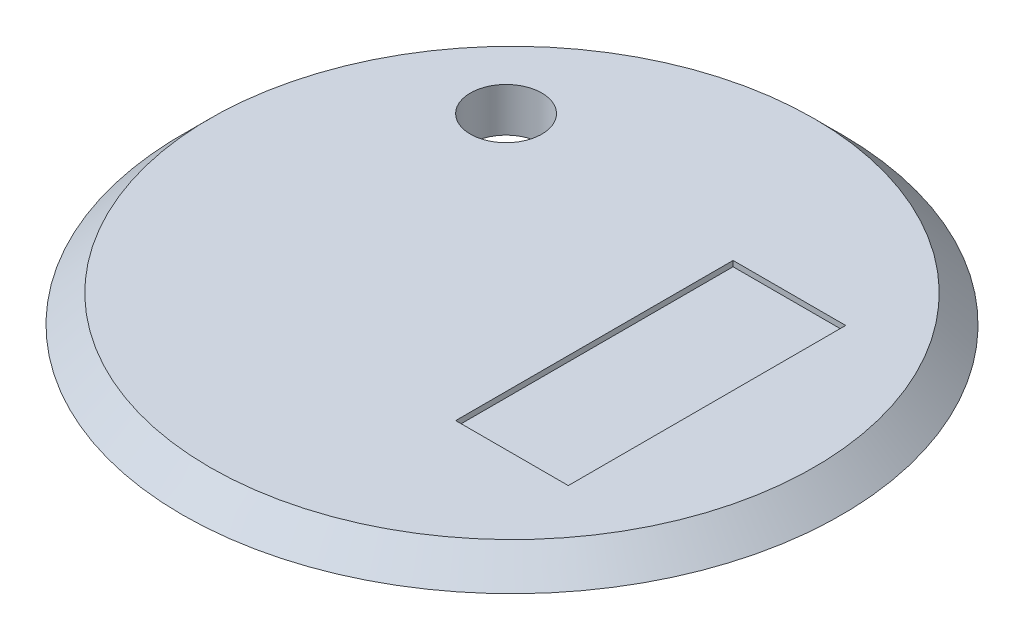
from build123d import *

# Parameters (mm, degrees)
SKETCH1_R           = 60
BOSS_EXTRUDE1_DEPTH = 5
SKETCH2_R           = 49.5
BOSS_EXTRUDE2_DEPTH = 3
CHAMFER1_SIZE       = 5
CAVITY3_START       = -3
CAVITY3_OUTLINE_R   = 1.03
CAVITY3_DEPTH       = 4.97
CAVITY3_START_2     = -0.09
CAVITY3_2_OUTLINE_R = 1.6995
CAVITY3_2_DEPTH     = 2.06
CAVITY3_START_3     = 1.97
CAVITY3_3_OUTLINE_R = 2.8325
CAVITY3_3_DEPTH     = 1.03
SKETCH3_R           = 1.03
SKETCH3_R_2         = 4.12
CUT_EXTRUDE1_DEPTH  = 4.97
SKETCH4_R           = 2.8325
CUT_EXTRUDE2_DEPTH  = 1
SKETCH5_W           = 20.5
SKETCH5_H           = 50.5
CUT_EXTRUDE3_DEPTH  = 1
SKETCH6_R           = 6.5
CUT_EXTRUDE4_DEPTH  = 86.229103011


with BuildPart() as part:
    # Sketch1 → Boss-Extrude1 (new body)
    with BuildSketch(Plane(origin=(0, 0, 0), x_dir=(1, 0, 0), z_dir=(0, 1, 0))):
        with Locations(Location((0, 0, 0), (0, 0, 270))):
            Circle(SKETCH1_R)
    extrude(amount=BOSS_EXTRUDE1_DEPTH)

    # Sketch2 → Boss-Extrude2 (add)
    with BuildSketch(Plane.XZ):
        with Locations(Location((0, 0, 0), (0, 0, 270))):
            Circle(SKETCH2_R)
    extrude(amount=BOSS_EXTRUDE2_DEPTH)

    # Chamfer1
    chamfer1_edges = [part.edges().sort_by_distance(p)[0] for p in [
        (0, 5, -60),
    ]]
    chamfer(chamfer1_edges, length=CHAMFER1_SIZE - 0.0001)  # a hair under: the kernel refuses the full size

    # Cavity3: read off the stored shape, not the designer's step
    # Cavity3 outline → Cavity3 (cut)
    with BuildSketch(Plane(origin=(0, 0, 0), x_dir=(1, 0, 0), z_dir=(0, 1, 0)).offset(CAVITY3_START)):
        with BuildLine():
            Line((24.463108255, 3.105757511), (8.115613404, 4.990999431))
            ThreePointArc((8.115613404, 4.990999431), (6.655003546, 6.817931068), (4.793285171, 8.233934267))
            Line((4.793285171, 8.233934267), (2.513273505, 24.531058916))
            ThreePointArc((2.513273505, 24.531058916), (-0.326157735, 26.970899519), (-3.105757511, 24.463108255))
            Line((-3.105757511, 24.463108255), (-4.990999431, 8.115613404))
            ThreePointArc((-4.990999431, 8.115613404), (-6.817931068, 6.655003546), (-8.233934267, 4.793285171))
            Line((-8.233934267, 4.793285171), (-24.531058916, 2.513273505))
            ThreePointArc((-24.531058916, 2.513273505), (-26.970899519, -0.326157735), (-24.463108255, -3.105757511))
            Line((-24.463108255, -3.105757511), (-8.115613404, -4.990999431))
            ThreePointArc((-8.115613404, -4.990999431), (-6.655003546, -6.817931068), (-4.793285171, -8.233934267))
            Line((-4.793285171, -8.233934267), (-2.513273505, -24.531058916))
            ThreePointArc((-2.513273505, -24.531058916), (0.326157735, -26.970899519), (3.105757511, -24.463108255))
            Line((3.105757511, -24.463108255), (4.990999431, -8.115613404))
            ThreePointArc((4.990999431, -8.115613404), (6.817931068, -6.655003546), (8.233934267, -4.793285171))
            Line((8.233934267, -4.793285171), (24.531058916, -2.513273505))
            ThreePointArc((24.531058916, -2.513273505), (26.970899519, 0.326157735), (24.463108255, 3.105757511))
        make_face()
        with Locations((-23.945749158, -0.289574743)):
            Circle(CAVITY3_OUTLINE_R, mode=Mode.SUBTRACT)
        with Locations((-18.796125683, -0.227300605)):
            Circle(CAVITY3_OUTLINE_R, mode=Mode.SUBTRACT)
        with Locations((-13.646502208, -0.165026467)):
            Circle(CAVITY3_OUTLINE_R, mode=Mode.SUBTRACT)
        with Locations((-8.496878733, -0.102752328)):
            Circle(CAVITY3_OUTLINE_R, mode=Mode.SUBTRACT)
        with BuildLine():
            Line((3.503478055, -0.1010505), (4.112023478, -0.256247761))
            ThreePointArc((4.112023478, -0.256247761), (4.090956911, -0.488335495), (4.056801586, -0.718860831))
            Line((4.056801586, -0.718860831), (3.428823838, -0.726454935))
            Line((3.428823838, -0.726454935), (3.357946141, -1.004374133))
            Line((3.357946141, -1.004374133), (3.905587875, -1.31178632))
            ThreePointArc((3.905587875, -1.31178632), (3.825170408, -1.530513428), (3.73251455, -1.744343755))
            Line((3.73251455, -1.744343755), (3.123969126, -1.589146495))
            Line((3.123969126, -1.589146495), (2.983575747, -1.839251328))
            Line((2.983575747, -1.839251328), (3.432992913, -2.27792881))
            ThreePointArc((3.432992913, -2.27792881), (3.298704863, -2.4683894), (3.153862816, -2.650952535))
            Line((3.153862816, -2.650952535), (2.606221081, -2.343540347))
            Line((2.606221081, -2.343540347), (2.405879596, -2.548786584))
            Line((2.405879596, -2.548786584), (2.726445157, -3.088834215))
            ThreePointArc((2.726445157, -3.088834215), (2.547438033, -3.238048713), (2.360280543, -3.37690328))
            Line((2.360280543, -3.37690328), (1.910863377, -2.938225798))
            Line((1.910863377, -2.938225798), (1.664226727, -3.084626247))
            Line((1.664226727, -3.084626247), (1.834094669, -3.689240673))
            ThreePointArc((1.834094669, -3.689240673), (1.622567511, -3.787040358), (1.405849051, -3.872723647))
            Line((1.405849051, -3.872723647), (1.085283491, -3.332676016))
            Line((1.085283491, -3.332676016), (0.809159557, -3.410253729))
            Line((0.809159557, -3.410253729), (0.81675366, -4.038231477))
            ThreePointArc((0.81675366, -4.038231477), (0.587121694, -4.077951461), (0.35561127, -4.104624298))
            Line((0.35561127, -4.104624298), (0.185743328, -3.500009871))
            Line((0.185743328, -3.500009871), (-0.1010505, -3.503478055))
            Line((-0.1010505, -3.503478055), (-0.256247761, -4.112023478))
            ThreePointArc((-0.256247761, -4.112023478), (-0.488335495, -4.090956911), (-0.718860831, -4.056801586))
            Line((-0.718860831, -4.056801586), (-0.726454935, -3.428823838))
            Line((-0.726454935, -3.428823838), (-1.004374133, -3.357946141))
            Line((-1.004374133, -3.357946141), (-1.31178632, -3.905587875))
            ThreePointArc((-1.31178632, -3.905587875), (-1.530513428, -3.825170408), (-1.744343755, -3.73251455))
            Line((-1.744343755, -3.73251455), (-1.589146495, -3.123969126))
            Line((-1.589146495, -3.123969126), (-1.839251328, -2.983575747))
            Line((-1.839251328, -2.983575747), (-2.27792881, -3.432992913))
            ThreePointArc((-2.27792881, -3.432992913), (-2.4683894, -3.298704863), (-2.650952535, -3.153862816))
            Line((-2.650952535, -3.153862816), (-2.343540347, -2.606221081))
            Line((-2.343540347, -2.606221081), (-2.548786584, -2.405879596))
            Line((-2.548786584, -2.405879596), (-3.088834215, -2.726445157))
            ThreePointArc((-3.088834215, -2.726445157), (-3.238048713, -2.547438033), (-3.37690328, -2.360280543))
            Line((-3.37690328, -2.360280543), (-2.938225798, -1.910863377))
            Line((-2.938225798, -1.910863377), (-3.084626247, -1.664226727))
            Line((-3.084626247, -1.664226727), (-3.689240673, -1.834094669))
            ThreePointArc((-3.689240673, -1.834094669), (-3.787040358, -1.622567511), (-3.872723647, -1.405849051))
            Line((-3.872723647, -1.405849051), (-3.332676016, -1.085283491))
            Line((-3.332676016, -1.085283491), (-3.410253729, -0.809159557))
            Line((-3.410253729, -0.809159557), (-4.038231477, -0.81675366))
            ThreePointArc((-4.038231477, -0.81675366), (-4.077951461, -0.587121694), (-4.104624298, -0.35561127))
            Line((-4.104624298, -0.35561127), (-3.500009871, -0.185743328))
            Line((-3.500009871, -0.185743328), (-3.503478055, 0.1010505))
            Line((-3.503478055, 0.1010505), (-4.112023478, 0.256247761))
            ThreePointArc((-4.112023478, 0.256247761), (-4.090956911, 0.488335495), (-4.056801586, 0.718860831))
            Line((-4.056801586, 0.718860831), (-3.428823838, 0.726454935))
            Line((-3.428823838, 0.726454935), (-3.357946141, 1.004374133))
            Line((-3.357946141, 1.004374133), (-3.905587875, 1.31178632))
            ThreePointArc((-3.905587875, 1.31178632), (-3.825170408, 1.530513428), (-3.73251455, 1.744343755))
            Line((-3.73251455, 1.744343755), (-3.123969126, 1.589146495))
            Line((-3.123969126, 1.589146495), (-2.983575747, 1.839251328))
            Line((-2.983575747, 1.839251328), (-3.432992913, 2.27792881))
            ThreePointArc((-3.432992913, 2.27792881), (-3.298704863, 2.4683894), (-3.153862816, 2.650952535))
            Line((-3.153862816, 2.650952535), (-2.606221081, 2.343540347))
            Line((-2.606221081, 2.343540347), (-2.405879596, 2.548786584))
            Line((-2.405879596, 2.548786584), (-2.726445157, 3.088834215))
            ThreePointArc((-2.726445157, 3.088834215), (-2.547438033, 3.238048713), (-2.360280543, 3.37690328))
            Line((-2.360280543, 3.37690328), (-1.910863377, 2.938225798))
            Line((-1.910863377, 2.938225798), (-1.664226727, 3.084626247))
            Line((-1.664226727, 3.084626247), (-1.834094669, 3.689240673))
            ThreePointArc((-1.834094669, 3.689240673), (-1.622567511, 3.787040358), (-1.405849051, 3.872723647))
            Line((-1.405849051, 3.872723647), (-1.085283491, 3.332676016))
            Line((-1.085283491, 3.332676016), (-0.809159557, 3.410253729))
            Line((-0.809159557, 3.410253729), (-0.81675366, 4.038231477))
            ThreePointArc((-0.81675366, 4.038231477), (-0.587121694, 4.077951461), (-0.35561127, 4.104624298))
            Line((-0.35561127, 4.104624298), (-0.185743328, 3.500009871))
            Line((-0.185743328, 3.500009871), (0.1010505, 3.503478055))
            Line((0.1010505, 3.503478055), (0.256247761, 4.112023478))
            ThreePointArc((0.256247761, 4.112023478), (0.488335495, 4.090956911), (0.718860831, 4.056801586))
            Line((0.718860831, 4.056801586), (0.726454935, 3.428823838))
            Line((0.726454935, 3.428823838), (1.004374133, 3.357946141))
            Line((1.004374133, 3.357946141), (1.31178632, 3.905587875))
            ThreePointArc((1.31178632, 3.905587875), (1.530513428, 3.825170408), (1.744343755, 3.73251455))
            Line((1.744343755, 3.73251455), (1.589146495, 3.123969126))
            Line((1.589146495, 3.123969126), (1.839251328, 2.983575747))
            Line((1.839251328, 2.983575747), (2.27792881, 3.432992913))
            ThreePointArc((2.27792881, 3.432992913), (2.4683894, 3.298704863), (2.650952535, 3.153862816))
            Line((2.650952535, 3.153862816), (2.343540347, 2.606221081))
            Line((2.343540347, 2.606221081), (2.548786584, 2.405879596))
            Line((2.548786584, 2.405879596), (3.088834215, 2.726445157))
            ThreePointArc((3.088834215, 2.726445157), (3.238048713, 2.547438033), (3.37690328, 2.360280543))
            Line((3.37690328, 2.360280543), (2.938225798, 1.910863377))
            Line((2.938225798, 1.910863377), (3.084626247, 1.664226727))
            Line((3.084626247, 1.664226727), (3.689240673, 1.834094669))
            ThreePointArc((3.689240673, 1.834094669), (3.787040358, 1.622567511), (3.872723647, 1.405849051))
            Line((3.872723647, 1.405849051), (3.332676016, 1.085283491))
            Line((3.332676016, 1.085283491), (3.410253729, 0.809159557))
            Line((3.410253729, 0.809159557), (4.038231477, 0.81675366))
            ThreePointArc((4.038231477, 0.81675366), (4.077951461, 0.587121694), (4.104624298, 0.35561127))
            Line((4.104624298, 0.35561127), (3.500009871, 0.185743328))
            Line((3.500009871, 0.185743328), (3.503478055, -0.1010505))
        make_face(mode=Mode.SUBTRACT)
        with Locations((0.289574743, -23.945749158)):
            Circle(CAVITY3_OUTLINE_R, mode=Mode.SUBTRACT)
        with Locations((0.227300605, -18.796125683)):
            Circle(CAVITY3_OUTLINE_R, mode=Mode.SUBTRACT)
        with Locations((0.165026467, -13.646502208)):
            Circle(CAVITY3_OUTLINE_R, mode=Mode.SUBTRACT)
        with Locations((0.102752328, -8.496878733)):
            Circle(CAVITY3_OUTLINE_R, mode=Mode.SUBTRACT)
        with Locations((-0.102752328, 8.496878733)):
            Circle(CAVITY3_OUTLINE_R, mode=Mode.SUBTRACT)
        with Locations((-0.165026467, 13.646502208)):
            Circle(CAVITY3_OUTLINE_R, mode=Mode.SUBTRACT)
        with Locations((-0.227300605, 18.796125683)):
            Circle(CAVITY3_OUTLINE_R, mode=Mode.SUBTRACT)
        with Locations((-0.289574743, 23.945749158)):
            Circle(CAVITY3_OUTLINE_R, mode=Mode.SUBTRACT)
        with Locations((8.496878733, 0.102752328)):
            Circle(CAVITY3_OUTLINE_R, mode=Mode.SUBTRACT)
        with Locations((13.646502208, 0.165026467)):
            Circle(CAVITY3_OUTLINE_R, mode=Mode.SUBTRACT)
        with Locations((18.796125683, 0.227300605)):
            Circle(CAVITY3_OUTLINE_R, mode=Mode.SUBTRACT)
        with Locations((23.945749158, 0.289574743)):
            Circle(CAVITY3_OUTLINE_R, mode=Mode.SUBTRACT)
    extrude(amount=CAVITY3_DEPTH, mode=Mode.SUBTRACT)

    # Cavity3 2 outline → Cavity3 2 (cut)
    with BuildSketch(Plane(origin=(0, 0, 0), x_dir=(1, 0, 0), z_dir=(0, 1, 0)).offset(CAVITY3_START_2)):
        with BuildLine():
            ThreePointArc((4.056801586, -0.718860831), (4.090956911, -0.488335495), (4.112023478, -0.256247761))
            Line((4.112023478, -0.256247761), (3.503478055, -0.1010505))
            Line((3.503478055, -0.1010505), (3.500009871, 0.185743328))
            Line((3.500009871, 0.185743328), (4.104624298, 0.35561127))
            ThreePointArc((4.104624298, 0.35561127), (4.077951461, 0.587121694), (4.038231477, 0.81675366))
            Line((4.038231477, 0.81675366), (3.410253729, 0.809159557))
            Line((3.410253729, 0.809159557), (3.332676016, 1.085283491))
            Line((3.332676016, 1.085283491), (3.872723647, 1.405849051))
            ThreePointArc((3.872723647, 1.405849051), (3.787040358, 1.622567511), (3.689240673, 1.834094669))
            Line((3.689240673, 1.834094669), (3.084626247, 1.664226727))
            Line((3.084626247, 1.664226727), (2.938225798, 1.910863377))
            Line((2.938225798, 1.910863377), (3.37690328, 2.360280543))
            ThreePointArc((3.37690328, 2.360280543), (3.238048713, 2.547438033), (3.088834215, 2.726445157))
            Line((3.088834215, 2.726445157), (2.548786584, 2.405879596))
            Line((2.548786584, 2.405879596), (2.343540347, 2.606221081))
            Line((2.343540347, 2.606221081), (2.650952535, 3.153862816))
            ThreePointArc((2.650952535, 3.153862816), (2.4683894, 3.298704863), (2.27792881, 3.432992913))
            Line((2.27792881, 3.432992913), (1.839251328, 2.983575747))
            Line((1.839251328, 2.983575747), (1.589146495, 3.123969126))
            Line((1.589146495, 3.123969126), (1.744343755, 3.73251455))
            ThreePointArc((1.744343755, 3.73251455), (1.530513428, 3.825170408), (1.31178632, 3.905587875))
            Line((1.31178632, 3.905587875), (1.004374133, 3.357946141))
            Line((1.004374133, 3.357946141), (0.726454935, 3.428823838))
            Line((0.726454935, 3.428823838), (0.718860831, 4.056801586))
            ThreePointArc((0.718860831, 4.056801586), (0.488335495, 4.090956911), (0.256247761, 4.112023478))
            Line((0.256247761, 4.112023478), (0.1010505, 3.503478055))
            Line((0.1010505, 3.503478055), (-0.185743328, 3.500009871))
            Line((-0.185743328, 3.500009871), (-0.35561127, 4.104624298))
            ThreePointArc((-0.35561127, 4.104624298), (-0.587121694, 4.077951461), (-0.81675366, 4.038231477))
            Line((-0.81675366, 4.038231477), (-0.809159557, 3.410253729))
            Line((-0.809159557, 3.410253729), (-1.085283491, 3.332676016))
            Line((-1.085283491, 3.332676016), (-1.405849051, 3.872723647))
            ThreePointArc((-1.405849051, 3.872723647), (-1.622567511, 3.787040358), (-1.834094669, 3.689240673))
            Line((-1.834094669, 3.689240673), (-1.664226727, 3.084626247))
            Line((-1.664226727, 3.084626247), (-1.910863377, 2.938225798))
            Line((-1.910863377, 2.938225798), (-2.360280543, 3.37690328))
            ThreePointArc((-2.360280543, 3.37690328), (-2.547438033, 3.238048713), (-2.726445157, 3.088834215))
            Line((-2.726445157, 3.088834215), (-2.405879596, 2.548786584))
            Line((-2.405879596, 2.548786584), (-2.606221081, 2.343540347))
            Line((-2.606221081, 2.343540347), (-3.153862816, 2.650952535))
            ThreePointArc((-3.153862816, 2.650952535), (-3.298704863, 2.4683894), (-3.432992913, 2.27792881))
            Line((-3.432992913, 2.27792881), (-2.983575747, 1.839251328))
            Line((-2.983575747, 1.839251328), (-3.123969126, 1.589146495))
            Line((-3.123969126, 1.589146495), (-3.73251455, 1.744343755))
            ThreePointArc((-3.73251455, 1.744343755), (-3.825170408, 1.530513428), (-3.905587875, 1.31178632))
            Line((-3.905587875, 1.31178632), (-3.357946141, 1.004374133))
            Line((-3.357946141, 1.004374133), (-3.428823838, 0.726454935))
            Line((-3.428823838, 0.726454935), (-4.056801586, 0.718860831))
            ThreePointArc((-4.056801586, 0.718860831), (-4.090956911, 0.488335495), (-4.112023478, 0.256247761))
            Line((-4.112023478, 0.256247761), (-3.503478055, 0.1010505))
            Line((-3.503478055, 0.1010505), (-3.500009871, -0.185743328))
            Line((-3.500009871, -0.185743328), (-4.104624298, -0.35561127))
            ThreePointArc((-4.104624298, -0.35561127), (-4.077951461, -0.587121694), (-4.038231477, -0.81675366))
            Line((-4.038231477, -0.81675366), (-3.410253729, -0.809159557))
            Line((-3.410253729, -0.809159557), (-3.332676016, -1.085283491))
            Line((-3.332676016, -1.085283491), (-3.872723647, -1.405849051))
            ThreePointArc((-3.872723647, -1.405849051), (-3.787040358, -1.622567511), (-3.689240673, -1.834094669))
            Line((-3.689240673, -1.834094669), (-3.084626247, -1.664226727))
            Line((-3.084626247, -1.664226727), (-2.938225798, -1.910863377))
            Line((-2.938225798, -1.910863377), (-3.37690328, -2.360280543))
            ThreePointArc((-3.37690328, -2.360280543), (-3.238048713, -2.547438033), (-3.088834215, -2.726445157))
            Line((-3.088834215, -2.726445157), (-2.548786584, -2.405879596))
            Line((-2.548786584, -2.405879596), (-2.343540347, -2.606221081))
            Line((-2.343540347, -2.606221081), (-2.650952535, -3.153862816))
            ThreePointArc((-2.650952535, -3.153862816), (-2.4683894, -3.298704863), (-2.27792881, -3.432992913))
            Line((-2.27792881, -3.432992913), (-1.839251328, -2.983575747))
            Line((-1.839251328, -2.983575747), (-1.589146495, -3.123969126))
            Line((-1.589146495, -3.123969126), (-1.744343755, -3.73251455))
            ThreePointArc((-1.744343755, -3.73251455), (-1.530513428, -3.825170408), (-1.31178632, -3.905587875))
            Line((-1.31178632, -3.905587875), (-1.004374133, -3.357946141))
            Line((-1.004374133, -3.357946141), (-0.726454935, -3.428823838))
            Line((-0.726454935, -3.428823838), (-0.718860831, -4.056801586))
            ThreePointArc((-0.718860831, -4.056801586), (-0.488335495, -4.090956911), (-0.256247761, -4.112023478))
            Line((-0.256247761, -4.112023478), (-0.1010505, -3.503478055))
            Line((-0.1010505, -3.503478055), (0.185743328, -3.500009871))
            Line((0.185743328, -3.500009871), (0.35561127, -4.104624298))
            ThreePointArc((0.35561127, -4.104624298), (0.587121694, -4.077951461), (0.81675366, -4.038231477))
            Line((0.81675366, -4.038231477), (0.809159557, -3.410253729))
            Line((0.809159557, -3.410253729), (1.085283491, -3.332676016))
            Line((1.085283491, -3.332676016), (1.405849051, -3.872723647))
            ThreePointArc((1.405849051, -3.872723647), (1.622567511, -3.787040358), (1.834094669, -3.689240673))
            Line((1.834094669, -3.689240673), (1.664226727, -3.084626247))
            Line((1.664226727, -3.084626247), (1.910863377, -2.938225798))
            Line((1.910863377, -2.938225798), (2.360280543, -3.37690328))
            ThreePointArc((2.360280543, -3.37690328), (2.547438033, -3.238048713), (2.726445157, -3.088834215))
            Line((2.726445157, -3.088834215), (2.405879596, -2.548786584))
            Line((2.405879596, -2.548786584), (2.606221081, -2.343540347))
            Line((2.606221081, -2.343540347), (3.153862816, -2.650952535))
            ThreePointArc((3.153862816, -2.650952535), (3.298704863, -2.4683894), (3.432992913, -2.27792881))
            Line((3.432992913, -2.27792881), (2.983575747, -1.839251328))
            Line((2.983575747, -1.839251328), (3.123969126, -1.589146495))
            Line((3.123969126, -1.589146495), (3.73251455, -1.744343755))
            ThreePointArc((3.73251455, -1.744343755), (3.825170408, -1.530513428), (3.905587875, -1.31178632))
            Line((3.905587875, -1.31178632), (3.357946141, -1.004374133))
            Line((3.357946141, -1.004374133), (3.428823838, -0.726454935))
            Line((3.428823838, -0.726454935), (4.056801586, -0.718860831))
        make_face()
        Circle(CAVITY3_2_OUTLINE_R, mode=Mode.SUBTRACT)
    extrude(amount=CAVITY3_2_DEPTH, mode=Mode.SUBTRACT)

    # Cavity3 3 outline → Cavity3 3 (cut)
    with BuildSketch(Plane(origin=(0, 0, 0), x_dir=(1, 0, 0), z_dir=(0, 1, 0)).offset(CAVITY3_START_3)):
        with BuildLine():
            ThreePointArc((4.056801586, -0.718860831), (4.090956911, -0.488335495), (4.112023478, -0.256247761))
            Line((4.112023478, -0.256247761), (3.503478055, -0.1010505))
            Line((3.503478055, -0.1010505), (3.500009871, 0.185743328))
            Line((3.500009871, 0.185743328), (4.104624298, 0.35561127))
            ThreePointArc((4.104624298, 0.35561127), (4.077951461, 0.587121694), (4.038231477, 0.81675366))
            Line((4.038231477, 0.81675366), (3.410253729, 0.809159557))
            Line((3.410253729, 0.809159557), (3.332676016, 1.085283491))
            Line((3.332676016, 1.085283491), (3.872723647, 1.405849051))
            ThreePointArc((3.872723647, 1.405849051), (3.787040358, 1.622567511), (3.689240673, 1.834094669))
            Line((3.689240673, 1.834094669), (3.084626247, 1.664226727))
            Line((3.084626247, 1.664226727), (2.938225798, 1.910863377))
            Line((2.938225798, 1.910863377), (3.37690328, 2.360280543))
            ThreePointArc((3.37690328, 2.360280543), (3.238048713, 2.547438033), (3.088834215, 2.726445157))
            Line((3.088834215, 2.726445157), (2.548786584, 2.405879596))
            Line((2.548786584, 2.405879596), (2.343540347, 2.606221081))
            Line((2.343540347, 2.606221081), (2.650952535, 3.153862816))
            ThreePointArc((2.650952535, 3.153862816), (2.4683894, 3.298704863), (2.27792881, 3.432992913))
            Line((2.27792881, 3.432992913), (1.839251328, 2.983575747))
            Line((1.839251328, 2.983575747), (1.589146495, 3.123969126))
            Line((1.589146495, 3.123969126), (1.744343755, 3.73251455))
            ThreePointArc((1.744343755, 3.73251455), (1.530513428, 3.825170408), (1.31178632, 3.905587875))
            Line((1.31178632, 3.905587875), (1.004374133, 3.357946141))
            Line((1.004374133, 3.357946141), (0.726454935, 3.428823838))
            Line((0.726454935, 3.428823838), (0.718860831, 4.056801586))
            ThreePointArc((0.718860831, 4.056801586), (0.488335495, 4.090956911), (0.256247761, 4.112023478))
            Line((0.256247761, 4.112023478), (0.1010505, 3.503478055))
            Line((0.1010505, 3.503478055), (-0.185743328, 3.500009871))
            Line((-0.185743328, 3.500009871), (-0.35561127, 4.104624298))
            ThreePointArc((-0.35561127, 4.104624298), (-0.587121694, 4.077951461), (-0.81675366, 4.038231477))
            Line((-0.81675366, 4.038231477), (-0.809159557, 3.410253729))
            Line((-0.809159557, 3.410253729), (-1.085283491, 3.332676016))
            Line((-1.085283491, 3.332676016), (-1.405849051, 3.872723647))
            ThreePointArc((-1.405849051, 3.872723647), (-1.622567511, 3.787040358), (-1.834094669, 3.689240673))
            Line((-1.834094669, 3.689240673), (-1.664226727, 3.084626247))
            Line((-1.664226727, 3.084626247), (-1.910863377, 2.938225798))
            Line((-1.910863377, 2.938225798), (-2.360280543, 3.37690328))
            ThreePointArc((-2.360280543, 3.37690328), (-2.547438033, 3.238048713), (-2.726445157, 3.088834215))
            Line((-2.726445157, 3.088834215), (-2.405879596, 2.548786584))
            Line((-2.405879596, 2.548786584), (-2.606221081, 2.343540347))
            Line((-2.606221081, 2.343540347), (-3.153862816, 2.650952535))
            ThreePointArc((-3.153862816, 2.650952535), (-3.298704863, 2.4683894), (-3.432992913, 2.27792881))
            Line((-3.432992913, 2.27792881), (-2.983575747, 1.839251328))
            Line((-2.983575747, 1.839251328), (-3.123969126, 1.589146495))
            Line((-3.123969126, 1.589146495), (-3.73251455, 1.744343755))
            ThreePointArc((-3.73251455, 1.744343755), (-3.825170408, 1.530513428), (-3.905587875, 1.31178632))
            Line((-3.905587875, 1.31178632), (-3.357946141, 1.004374133))
            Line((-3.357946141, 1.004374133), (-3.428823838, 0.726454935))
            Line((-3.428823838, 0.726454935), (-4.056801586, 0.718860831))
            ThreePointArc((-4.056801586, 0.718860831), (-4.090956911, 0.488335495), (-4.112023478, 0.256247761))
            Line((-4.112023478, 0.256247761), (-3.503478055, 0.1010505))
            Line((-3.503478055, 0.1010505), (-3.500009871, -0.185743328))
            Line((-3.500009871, -0.185743328), (-4.104624298, -0.35561127))
            ThreePointArc((-4.104624298, -0.35561127), (-4.077951461, -0.587121694), (-4.038231477, -0.81675366))
            Line((-4.038231477, -0.81675366), (-3.410253729, -0.809159557))
            Line((-3.410253729, -0.809159557), (-3.332676016, -1.085283491))
            Line((-3.332676016, -1.085283491), (-3.872723647, -1.405849051))
            ThreePointArc((-3.872723647, -1.405849051), (-3.787040358, -1.622567511), (-3.689240673, -1.834094669))
            Line((-3.689240673, -1.834094669), (-3.084626247, -1.664226727))
            Line((-3.084626247, -1.664226727), (-2.938225798, -1.910863377))
            Line((-2.938225798, -1.910863377), (-3.37690328, -2.360280543))
            ThreePointArc((-3.37690328, -2.360280543), (-3.238048713, -2.547438033), (-3.088834215, -2.726445157))
            Line((-3.088834215, -2.726445157), (-2.548786584, -2.405879596))
            Line((-2.548786584, -2.405879596), (-2.343540347, -2.606221081))
            Line((-2.343540347, -2.606221081), (-2.650952535, -3.153862816))
            ThreePointArc((-2.650952535, -3.153862816), (-2.4683894, -3.298704863), (-2.27792881, -3.432992913))
            Line((-2.27792881, -3.432992913), (-1.839251328, -2.983575747))
            Line((-1.839251328, -2.983575747), (-1.589146495, -3.123969126))
            Line((-1.589146495, -3.123969126), (-1.744343755, -3.73251455))
            ThreePointArc((-1.744343755, -3.73251455), (-1.530513428, -3.825170408), (-1.31178632, -3.905587875))
            Line((-1.31178632, -3.905587875), (-1.004374133, -3.357946141))
            Line((-1.004374133, -3.357946141), (-0.726454935, -3.428823838))
            Line((-0.726454935, -3.428823838), (-0.718860831, -4.056801586))
            ThreePointArc((-0.718860831, -4.056801586), (-0.488335495, -4.090956911), (-0.256247761, -4.112023478))
            Line((-0.256247761, -4.112023478), (-0.1010505, -3.503478055))
            Line((-0.1010505, -3.503478055), (0.185743328, -3.500009871))
            Line((0.185743328, -3.500009871), (0.35561127, -4.104624298))
            ThreePointArc((0.35561127, -4.104624298), (0.587121694, -4.077951461), (0.81675366, -4.038231477))
            Line((0.81675366, -4.038231477), (0.809159557, -3.410253729))
            Line((0.809159557, -3.410253729), (1.085283491, -3.332676016))
            Line((1.085283491, -3.332676016), (1.405849051, -3.872723647))
            ThreePointArc((1.405849051, -3.872723647), (1.622567511, -3.787040358), (1.834094669, -3.689240673))
            Line((1.834094669, -3.689240673), (1.664226727, -3.084626247))
            Line((1.664226727, -3.084626247), (1.910863377, -2.938225798))
            Line((1.910863377, -2.938225798), (2.360280543, -3.37690328))
            ThreePointArc((2.360280543, -3.37690328), (2.547438033, -3.238048713), (2.726445157, -3.088834215))
            Line((2.726445157, -3.088834215), (2.405879596, -2.548786584))
            Line((2.405879596, -2.548786584), (2.606221081, -2.343540347))
            Line((2.606221081, -2.343540347), (3.153862816, -2.650952535))
            ThreePointArc((3.153862816, -2.650952535), (3.298704863, -2.4683894), (3.432992913, -2.27792881))
            Line((3.432992913, -2.27792881), (2.983575747, -1.839251328))
            Line((2.983575747, -1.839251328), (3.123969126, -1.589146495))
            Line((3.123969126, -1.589146495), (3.73251455, -1.744343755))
            ThreePointArc((3.73251455, -1.744343755), (3.825170408, -1.530513428), (3.905587875, -1.31178632))
            Line((3.905587875, -1.31178632), (3.357946141, -1.004374133))
            Line((3.357946141, -1.004374133), (3.428823838, -0.726454935))
            Line((3.428823838, -0.726454935), (4.056801586, -0.718860831))
        make_face()
        Circle(CAVITY3_3_OUTLINE_R, mode=Mode.SUBTRACT)
    extrude(amount=CAVITY3_3_DEPTH, mode=Mode.SUBTRACT)

    # Cavity3 4 outline → Cavity3 4 (revolve, cut)
    with BuildSketch(Plane.XY):
        Polygon((2.8325, 3), (2.8325, 1.97), (5.665, 1.97), (4.635, 3), align=None)
    revolve(axis=Axis((0, 0, 0), (0, 1, 0)), mode=Mode.SUBTRACT)

    # Sketch3 → Cut-Extrude1 (cut)
    with BuildSketch(Plane.XZ.offset(3)):
        with Locations((23.945749158, -0.289574743)):
            Circle(SKETCH3_R)
        with Locations((18.796125683, -0.227300605)):
            Circle(SKETCH3_R)
        with Locations((13.646502208, -0.165026467)):
            Circle(SKETCH3_R)
        with Locations((8.496878733, -0.102752328)):
            Circle(SKETCH3_R)
        with Locations((0.102752328, 8.496878733)):
            Circle(SKETCH3_R)
        with Locations((0.165026467, 13.646502208)):
            Circle(SKETCH3_R)
        with Locations((0.227300605, 18.796125683)):
            Circle(SKETCH3_R)
        with Locations((0.289574743, 23.945749158)):
            Circle(SKETCH3_R)
        with Locations((-8.496878733, 0.102752328)):
            Circle(SKETCH3_R)
        with Locations((-13.646502208, 0.165026467)):
            Circle(SKETCH3_R)
        with Locations((-18.796125683, 0.227300605)):
            Circle(SKETCH3_R)
        with Locations((-23.945749158, 0.289574743)):
            Circle(SKETCH3_R)
        with Locations((-0.102752328, -8.496878733)):
            Circle(SKETCH3_R)
        with Locations((-0.165026467, -13.646502208)):
            Circle(SKETCH3_R)
        with Locations((-0.227300605, -18.796125683)):
            Circle(SKETCH3_R)
        with Locations((-0.289574743, -23.945749158)):
            Circle(SKETCH3_R)
        Circle(SKETCH3_R_2)
    extrude(amount=-CUT_EXTRUDE1_DEPTH, mode=Mode.SUBTRACT)

    # Sketch4 → Cut-Extrude2 (cut)
    with BuildSketch(Plane.XZ.offset(-1.97)):
        with Locations(Location((0, 0, 0), (0, 0, 359.307158785))):
            Circle(SKETCH4_R)
    extrude(amount=-CUT_EXTRUDE2_DEPTH, mode=Mode.SUBTRACT)

    # Sketch5 → Cut-Extrude3 (cut)
    with BuildSketch(Plane(origin=(0, 5, 0), x_dir=(1, 0, 0), z_dir=(0, 1, 0))):
        with Locations((25.25, 0)):
            Rectangle(SKETCH5_W, SKETCH5_H)
    extrude(amount=-CUT_EXTRUDE3_DEPTH, mode=Mode.SUBTRACT)

    # Sketch6 → Cut-Extrude4 (cut, through all)
    with BuildSketch(Plane.XZ.offset(3)):
        with Locations(Location((-28.81795203, -27.740325175, 0), (0, 0, 270))):
            Circle(SKETCH6_R)
    extrude(amount=-CUT_EXTRUDE4_DEPTH, mode=Mode.SUBTRACT)


solid = part.part
